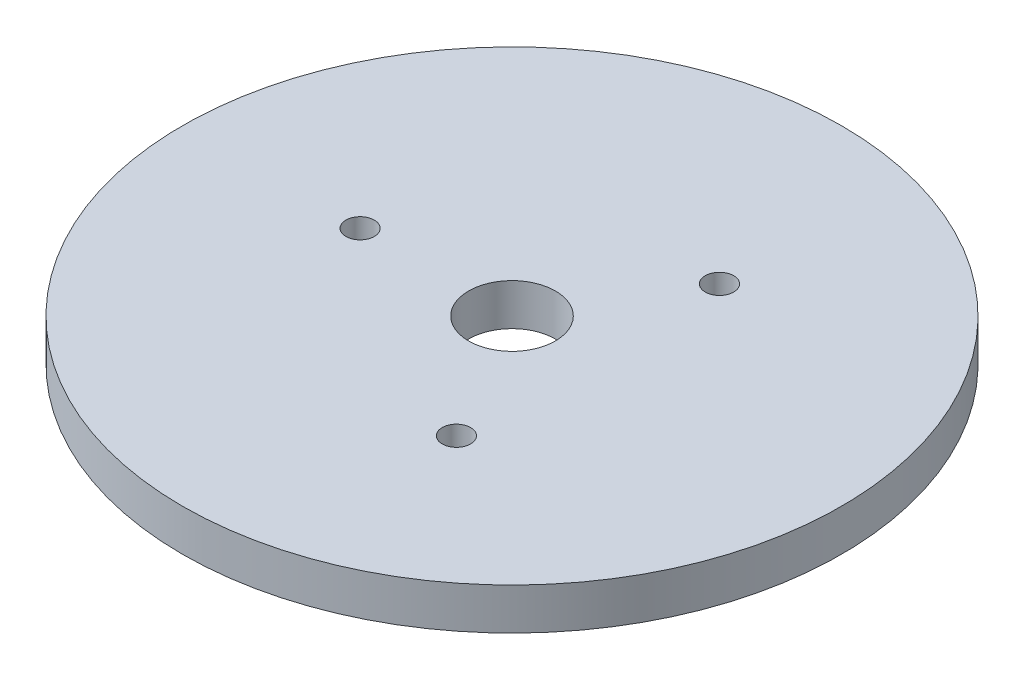
from build123d import *

# Parameters (mm, degrees)
SKETCH1_R           = 95
BOSS_EXTRUDE1_DEPTH = 12
SKETCH2_R           = 12.5
CUT_EXTRUDE1_DEPTH  = 135.88513632
SKETCH3_R           = 4.097397013
CUT_EXTRUDE2_DEPTH  = 8.474250982
CIRPATTERN1_COUNT   = 3


with BuildPart() as part:
    # Sketch1 → Boss-Extrude1 (new body)
    with BuildSketch(Plane(origin=(0, 0, 0), x_dir=(1, 0, 0), z_dir=(0, 1, 0))):
        Circle(SKETCH1_R)
    extrude(amount=BOSS_EXTRUDE1_DEPTH)

    # Sketch2 → Cut-Extrude1 (cut, through all)
    with BuildSketch(Plane(origin=(0, 0, 0), x_dir=(1, 0, 0), z_dir=(0, 1, 0))):
        Circle(SKETCH2_R)
    extrude(amount=CUT_EXTRUDE1_DEPTH, mode=Mode.SUBTRACT)

    # Sketch3 → Cut-Extrude2 (cut)
    with BuildSketch(Plane(origin=(0, 12, 0), x_dir=(1, 0, 0), z_dir=(0, 1, 0))):
        with Locations((-43.781298252, 0)):
            Circle(SKETCH3_R)
    cut_extrude2 = extrude(amount=-CUT_EXTRUDE2_DEPTH, mode=Mode.SUBTRACT)

    # CirPattern1: Cut-Extrude2 ×3 about axis
    cirpattern1_axis = Axis((0, 0, 0), (0, 1, 0))
    for i in range(1, CIRPATTERN1_COUNT):
        add(cut_extrude2.rotate(cirpattern1_axis, i * 360 / CIRPATTERN1_COUNT), mode=Mode.SUBTRACT)


solid = part.part
